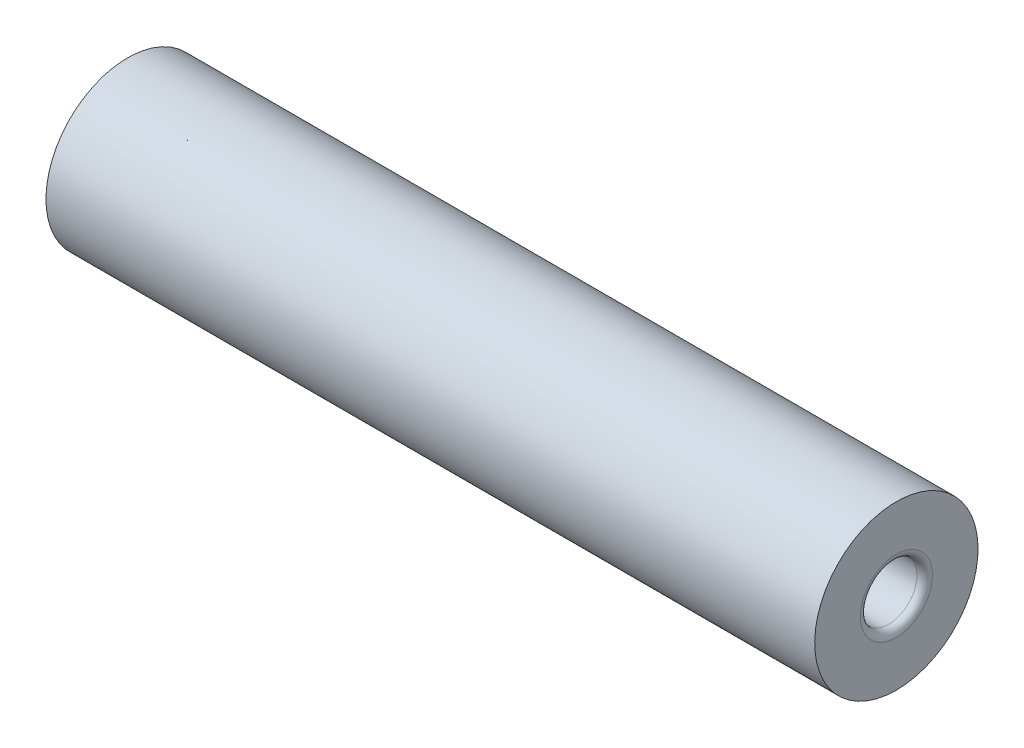
from build123d import *

# Parameters (mm, degrees)
TAP_DRILL_FOR_M4X0_7_TAP2_D     = 3.75
TAP_DRILL_FOR_M4X0_7_TAP2_DEPTH = 50.8
TAP_DRILL_FOR_M4X0_7_TAP2_TIP   = 1.126613661
FILLET1_R                       = 0.508


with BuildPart() as part:
    # Sketch1 → Revolve1 (revolve)
    with BuildSketch(Plane.XY):
        Polygon((0, 0), (0, 5.3975), (50.8, 5.3975), (50.8, 0), (37.892541774, 0), (12.907458226, 0), align=None)
    revolve(axis=Axis((0, 5.3975, 0), (1, 0, 0)))

    # Tap Drill for M4x0.7 Tap2
    with Locations(Plane.ZY):
        with Locations((0, 5.3975)):
            Hole(TAP_DRILL_FOR_M4X0_7_TAP2_D / 2, depth=TAP_DRILL_FOR_M4X0_7_TAP2_DEPTH)
            with Locations((0, 0, -(TAP_DRILL_FOR_M4X0_7_TAP2_DEPTH + TAP_DRILL_FOR_M4X0_7_TAP2_TIP / 2))):  # 118° drill point
                Cone(0, TAP_DRILL_FOR_M4X0_7_TAP2_D / 2, TAP_DRILL_FOR_M4X0_7_TAP2_TIP, mode=Mode.SUBTRACT)

    # Fillet1
    fillet1_edges = [part.edges().sort_by_distance(p)[0] for p in [
        (0, 5.3975, 1.875),
        (50.8, 5.3975, 1.875),
    ]]
    fillet(fillet1_edges, radius=FILLET1_R)


solid = part.part
